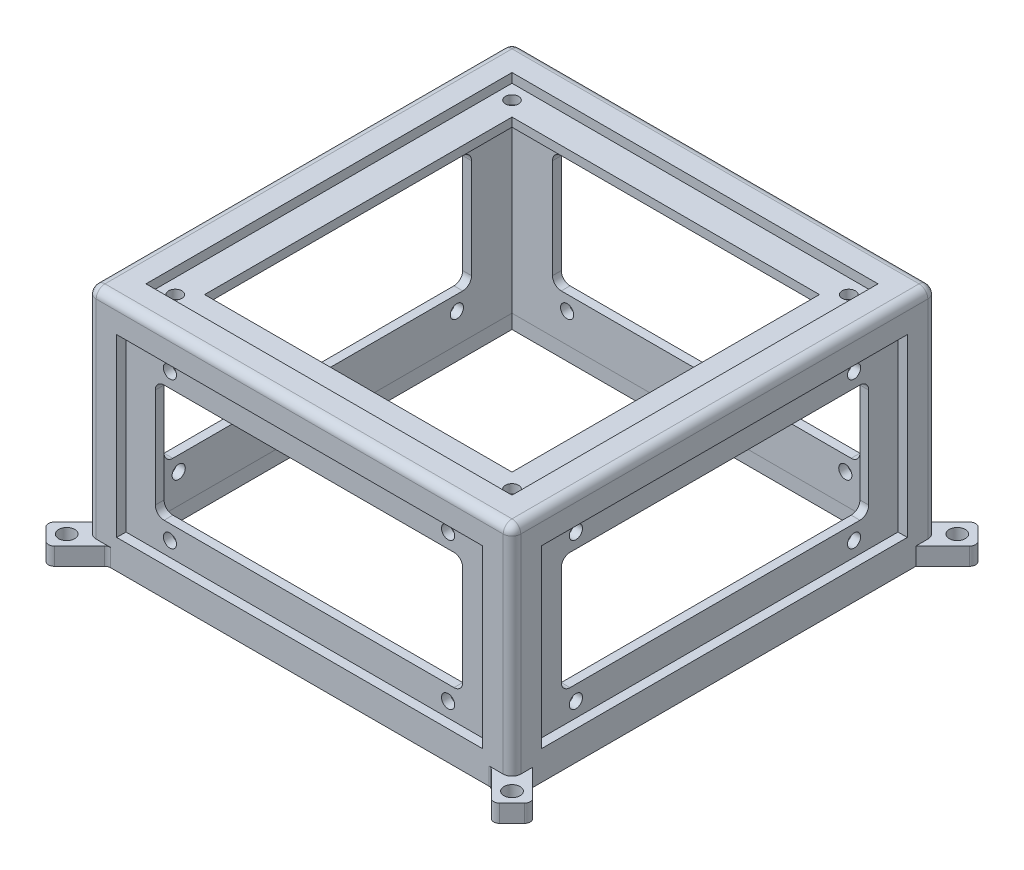
from build123d import *

# Parameters (mm, degrees)
SKETCH1_W               = 145
SKETCH1_H               = 145
BOSS_EXTRUDE1_DEPTH     = 80
SKETCH2_W               = 133
SKETCH2_H               = 133
CUT_EXTRUDE1_DEPTH      = 74
BOSS_EXTRUDE5_DEPTH     = 6
FILLET2_R               = 2
SKETCH13_R              = 2.75
CUT_EXTRUDE8_DEPTH      = 6
MIRROR6_OUTLINE_R       = 2.75
MIRROR6_DEPTH           = 6
MIRROR7_OUTLINE_R       = 2.75
MIRROR7_DEPTH           = 6
SKETCH4_W               = 125
SKETCH4_H               = 60
CUT_EXTRUDE2_DEPTH      = 10
BOSS_EXTRUDE3_START     = -3.175
SKETCH5_W               = 135
SKETCH5_H               = 70
SKETCH5_W_2             = 105
SKETCH5_H_2             = 40
BOSS_EXTRUDE3_DEPTH     = 3
SKETCH7_W               = 125
SKETCH7_H               = 60
CUT_EXTRUDE4_DEPTH      = 10
BOSS_EXTRUDE4_START     = -3.175
SKETCH8_W               = 135
SKETCH8_H               = 70
SKETCH8_W_2             = 105
SKETCH8_H_2             = 40
BOSS_EXTRUDE4_DEPTH     = 3
SKETCH9_R               = 2.25
CUT_EXTRUDE5_DEPTH      = 191.140002527
SKETCH10_R              = 2.25
CUT_EXTRUDE6_DEPTH      = 191.140002527
MIRROR8_COPY_1_SKETCH_R = 2.25
MIRROR8_COPY_1_DEPTH    = 191.140002527
BOSS_EXTRUDE6_START     = -3.175
SKETCH15_W              = 135
SKETCH15_H              = 135
SKETCH15_W_2            = 105
SKETCH15_H_2            = 105
BOSS_EXTRUDE6_DEPTH     = 3
SKETCH18_W              = 125
SKETCH18_H              = 125
CUT_EXTRUDE13_DEPTH     = 18
BOSS_EXTRUDE7_START     = -3.175
SKETCH19_W              = 135
SKETCH19_H              = 135
SKETCH19_W_2            = 105
SKETCH19_H_2            = 105
BOSS_EXTRUDE7_DEPTH     = 3
SKETCH20_R              = 2.25
CUT_EXTRUDE14_DEPTH     = 5
CHAMFER1_SIZE           = 4
FILLET3_R               = 3
FILLET4_R               = 3


# Read off the part's stored shape, not the designer's step: Mirror6, Mirror7
with BuildPart() as part:
    # Sketch1 → Boss-Extrude1 (new body)
    with BuildSketch(Plane(origin=(0, 0, 0), x_dir=(1, 0, 0), z_dir=(0, 1, 0))):
        Rectangle(SKETCH1_W, SKETCH1_H)
    extrude(amount=BOSS_EXTRUDE1_DEPTH)

    # Sketch2 → Cut-Extrude1 (cut)
    with BuildSketch(Plane.XZ):
        Rectangle(SKETCH2_W, SKETCH2_H)
    extrude(amount=-CUT_EXTRUDE1_DEPTH, mode=Mode.SUBTRACT)

    # Sketch11 → Boss-Extrude5 (add)
    with BuildSketch(Plane.XZ):
        Polygon((-70.035533906, 62.964466094), (-62.964466094, 70.035533906), (-76.035533906, 83.106601718), (-83.106601718, 76.035533906), align=None)
    extrude(amount=-BOSS_EXTRUDE5_DEPTH)

    # Fillet2
    fillet2_edges = [part.edges().sort_by_distance(p)[0] for p in [
        (-76.035533906, 3, 83.106601718),
        (-72.5, 3, 65.428932188),
        (-83.106601718, 3, 76.035533906),
        (-65.428932188, 3, 72.5),
    ]]
    fillet(fillet2_edges, radius=FILLET2_R)

    # Sketch13 → Cut-Extrude8 (cut)
    with BuildSketch(Plane(origin=(0, 6, 0), x_dir=(1, 0, 0), z_dir=(0, 1, 0))):
        with Locations(Location((-76.035533906, -76.035533906, 0), (0, 0, 270))):
            Circle(SKETCH13_R)
    extrude(amount=-CUT_EXTRUDE8_DEPTH, mode=Mode.SUBTRACT)

    # Mirror6 outline → Mirror6 (add)
    with BuildSketch(Plane(origin=(0, 0, 0), x_dir=(1, 0, 0), z_dir=(0, 1, 0))):
        with BuildLine():
            Line((81.692388155, -74.621320344), (72.5, -65.428932188))
            Line((72.5, -65.428932188), (72.5, -72.5))
            Line((72.5, -72.5), (64.600505063, -72.5))
            ThreePointArc((64.600505063, -72.5), (65.365871928, -72.652240935), (66.014718626, -73.085786438))
            Line((66.014718626, -73.085786438), (74.621320344, -81.692388155))
            ThreePointArc((74.621320344, -81.692388155), (76.035533906, -82.278174593), (77.449747468, -81.692388155))
            Line((77.449747468, -81.692388155), (81.692388155, -77.449747468))
            ThreePointArc((81.692388155, -77.449747468), (82.278174593, -76.035533906), (81.692388155, -74.621320344))
        make_face()
        with Locations((76.035533906, -76.035533906)):
            Circle(MIRROR6_OUTLINE_R, mode=Mode.SUBTRACT)
    extrude(amount=MIRROR6_DEPTH)

    # Mirror7 outline → Mirror7 (add)
    # profile 1 of 2: a face of its own
    with BuildSketch(Plane(origin=(0, 0, 0), x_dir=(1, 0, 0), z_dir=(0, 1, 0))):
        with BuildLine():
            ThreePointArc((77.449747468, 81.692388155), (76.035533906, 82.278174593), (74.621320344, 81.692388155))
            Line((74.621320344, 81.692388155), (65.428932188, 72.5))
            Line((65.428932188, 72.5), (72.5, 72.5))
            Line((72.5, 72.5), (72.5, 65.428932188))
            Line((72.5, 65.428932188), (81.692388155, 74.621320344))
            ThreePointArc((81.692388155, 74.621320344), (82.278174593, 76.035533906), (81.692388155, 77.449747468))
            Line((81.692388155, 77.449747468), (77.449747468, 81.692388155))
        make_face()
        with Locations((76.035533906, 76.035533906)):
            Circle(MIRROR7_OUTLINE_R, mode=Mode.SUBTRACT)
    # profile 2 of 2: a face of its own
    with BuildSketch(Plane(origin=(0, 0, 0), x_dir=(1, 0, 0), z_dir=(0, 1, 0))):
        with BuildLine():
            Line((-72.5, 72.5), (-65.428932188, 72.5))
            Line((-65.428932188, 72.5), (-74.621320344, 81.692388155))
            ThreePointArc((-74.621320344, 81.692388155), (-76.035533906, 82.278174593), (-77.449747468, 81.692388155))
            Line((-77.449747468, 81.692388155), (-81.692388155, 77.449747468))
            ThreePointArc((-81.692388155, 77.449747468), (-82.278174593, 76.035533906), (-81.692388155, 74.621320344))
            Line((-81.692388155, 74.621320344), (-73.085786438, 66.014718626))
            ThreePointArc((-73.085786438, 66.014718626), (-72.652240935, 65.365871928), (-72.5, 64.600505063))
            Line((-72.5, 64.600505063), (-72.5, 72.5))
        make_face()
        with Locations((-76.035533906, 76.035533906)):
            Circle(MIRROR7_OUTLINE_R, mode=Mode.SUBTRACT)
    extrude(amount=MIRROR7_DEPTH)

    # Sketch4 → Cut-Extrude2 (cut)
    with BuildSketch(Plane.XY.offset(72.5)):
        with Locations((0, 40)):
            Rectangle(SKETCH4_W, SKETCH4_H)
    cut_extrude2 = extrude(amount=-CUT_EXTRUDE2_DEPTH, mode=Mode.SUBTRACT)

    # Sketch5 → Boss-Extrude3 (add)
    with BuildSketch(Plane.XY.offset(72.5).offset(BOSS_EXTRUDE3_START)):
        with Locations((0, 40)):
            Rectangle(SKETCH5_W, SKETCH5_H)
        with Locations((0, 40)):
            Rectangle(SKETCH5_W_2, SKETCH5_H_2, mode=Mode.SUBTRACT)
    boss_extrude3 = extrude(amount=-BOSS_EXTRUDE3_DEPTH)

    # Mirror1: Cut-Extrude2, Boss-Extrude3 across plane
    add(cut_extrude2.mirror(Plane.XY), mode=Mode.SUBTRACT)
    add(boss_extrude3.mirror(Plane.XY))

    # Sketch7 → Cut-Extrude4 (cut)
    with BuildSketch(Plane.ZY.offset(72.5)):
        with Locations((0, 40)):
            Rectangle(SKETCH7_W, SKETCH7_H)
    cut_extrude4 = extrude(amount=-CUT_EXTRUDE4_DEPTH, mode=Mode.SUBTRACT)

    # Sketch8 → Boss-Extrude4 (add)
    with BuildSketch(Plane.ZY.offset(72.5).offset(BOSS_EXTRUDE4_START)):
        with Locations((0, 40)):
            Rectangle(SKETCH8_W, SKETCH8_H)
        with Locations((0, 40)):
            Rectangle(SKETCH8_W_2, SKETCH8_H_2, mode=Mode.SUBTRACT)
    boss_extrude4 = extrude(amount=-BOSS_EXTRUDE4_DEPTH)

    # Sketch9 → Cut-Extrude5 (cut, through all)
    with BuildSketch(Plane.ZY.offset(69.325)):
        with Locations((-47.5, 65)):
            Circle(SKETCH9_R)
        with Locations((-47.5, 15)):
            Circle(SKETCH9_R)
    cut_extrude5 = extrude(amount=-CUT_EXTRUDE5_DEPTH, mode=Mode.SUBTRACT)

    # Mirror4: Cut-Extrude5 across plane
    add(cut_extrude5.mirror(Plane.XY), mode=Mode.SUBTRACT)

    # Sketch10 → Cut-Extrude6 (cut, through all)
    with BuildSketch(Plane(origin=(0, 0, -69.325), x_dir=(-1, 0, 0), z_dir=(0, 0, -1))):
        with Locations((47.5, 65)):
            Circle(SKETCH10_R)
        with Locations((47.5, 15)):
            Circle(SKETCH10_R)
        with Locations((-47.5, 15)):
            Circle(SKETCH10_R)
        with Locations((-47.5, 65)):
            Circle(SKETCH10_R)
    extrude(amount=-CUT_EXTRUDE6_DEPTH, mode=Mode.SUBTRACT)

    # Mirror8: Cut-Extrude4, Boss-Extrude4, Cut-Extrude5 across plane
    add(cut_extrude4.mirror(Plane(origin=(0, 0, 0), x_dir=(0, 0, 1), z_dir=(1, 0, 0))), mode=Mode.SUBTRACT)
    add(boss_extrude4.mirror(Plane(origin=(0, 0, 0), x_dir=(0, 0, 1), z_dir=(1, 0, 0))))
    add(cut_extrude5.mirror(Plane(origin=(0, 0, 0), x_dir=(0, 0, 1), z_dir=(1, 0, 0))), mode=Mode.SUBTRACT)

    # Mirror8 copy 1 sketch → Mirror8 copy 1 (cut, through all)
    with BuildSketch(Plane(origin=(69.325, 0, 0), x_dir=(0, 0, -1), z_dir=(1, 0, 0))):
        with Locations((-47.5, 65)):
            Circle(MIRROR8_COPY_1_SKETCH_R)
        with Locations((-47.5, 15)):
            Circle(MIRROR8_COPY_1_SKETCH_R)
    extrude(amount=-MIRROR8_COPY_1_DEPTH, mode=Mode.SUBTRACT)

    # Sketch15 → Boss-Extrude6 (add)
    with BuildSketch(Plane(origin=(0, 80, 0), x_dir=(1, 0, 0), z_dir=(0, 1, 0)).offset(BOSS_EXTRUDE6_START)):
        Rectangle(SKETCH15_W, SKETCH15_H)
        Rectangle(SKETCH15_W_2, SKETCH15_H_2, mode=Mode.SUBTRACT)
    extrude(amount=-BOSS_EXTRUDE6_DEPTH)

    # Sketch18 → Cut-Extrude13 (cut)
    with BuildSketch(Plane(origin=(0, 80, 0), x_dir=(1, 0, 0), z_dir=(0, 1, 0))):
        Rectangle(SKETCH18_W, SKETCH18_H)
    extrude(amount=-CUT_EXTRUDE13_DEPTH, mode=Mode.SUBTRACT)

    # Sketch19 → Boss-Extrude7 (add)
    with BuildSketch(Plane(origin=(0, 80, 0), x_dir=(1, 0, 0), z_dir=(0, 1, 0)).offset(BOSS_EXTRUDE7_START)):
        Rectangle(SKETCH19_W, SKETCH19_H)
        Rectangle(SKETCH19_W_2, SKETCH19_H_2, mode=Mode.SUBTRACT)
    extrude(amount=-BOSS_EXTRUDE7_DEPTH)

    # Sketch20 → Cut-Extrude14 (cut)
    with BuildSketch(Plane(origin=(0, 76.825, 0), x_dir=(1, 0, 0), z_dir=(0, 1, 0))):
        with Locations(Location((-57.5, 57.5, 0), (0, 0, 270))):
            Circle(SKETCH20_R)
        with Locations(Location((-57.5, -57.5, 0), (0, 0, 270))):
            Circle(SKETCH20_R)
    cut_extrude14 = extrude(amount=-CUT_EXTRUDE14_DEPTH, mode=Mode.SUBTRACT)

    # Mirror11: Cut-Extrude14 across plane
    add(cut_extrude14.mirror(Plane(origin=(0, 0, 0), x_dir=(0, 0, 1), z_dir=(1, 0, 0))), mode=Mode.SUBTRACT)

    # Chamfer1
    chamfer1_edges = [part.edges().sort_by_distance(p)[0] for p in [
        (66.325, 73.825, 0),
        (0, 73.825, 66.325),
        (-66.325, 73.825, 0),
        (0, 73.825, -66.325),
    ]]
    chamfer(chamfer1_edges, length=CHAMFER1_SIZE)

    # Fillet3
    fillet3_edges = [part.edges().sort_by_distance(p)[0] for p in [
        (72.5, 80, 0),
        (0, 80, -72.5),
        (-72.5, 80, 0),
        (-72.5, 43, -72.5),
        (72.5, 43, -72.5),
        (72.5, 43, 72.5),
        (-72.5, 43, 72.5),
        (0, 80, 72.5),
    ]]
    fillet(fillet3_edges, radius=FILLET3_R)

    # Fillet4
    fillet4_edges = [part.edges().sort_by_distance(p)[0] for p in [
        (-52.5, 60, 67.825),
        (52.5, 60, 67.825),
        (52.5, 20, 67.825),
        (-52.5, 20, 67.825),
        (-52.5, 20, -67.825),
        (52.5, 20, -67.825),
        (52.5, 60, -67.825),
        (-52.5, 60, -67.825),
        (-67.825, 60, -52.5),
        (-67.825, 60, 52.5),
        (-67.825, 20, 52.5),
        (-67.825, 20, -52.5),
        (67.825, 20, -52.5),
        (67.825, 20, 52.5),
        (67.825, 60, 52.5),
        (67.825, 60, -52.5),
    ]]
    fillet(fillet4_edges, radius=FILLET4_R)


solid = part.part
